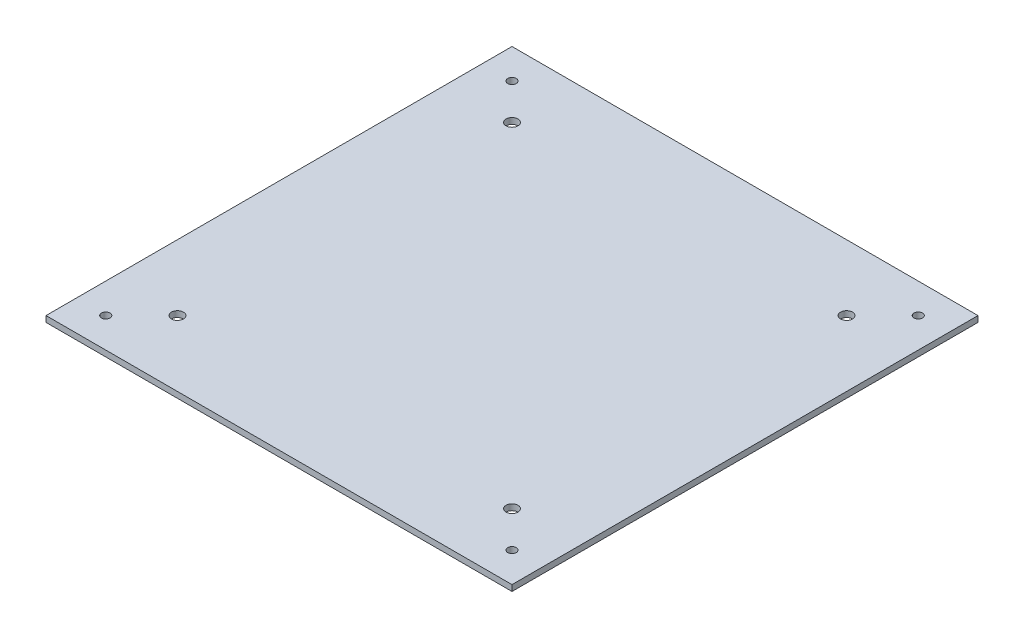
from build123d import *

# Parameters (mm, degrees)
SKETCH1_W           = 241.3
SKETCH1_H           = 241.3
BOSS_EXTRUDE1_DEPTH = 3.175
SKETCH2_R           = 3.175
SKETCH2_R_2         = 2.286
CUT_EXTRUDE1_DEPTH  = 342.264502439
SKETCH3_W           = 247.65
SKETCH3_H           = 247.65
SKETCH3_W_2         = 241.3
SKETCH3_H_2         = 241.3
BOSS_EXTRUDE2_DEPTH = 3.175


with BuildPart() as part:
    # Sketch1 → Boss-Extrude1 (new body)
    with BuildSketch(Plane(origin=(0, 0, 0), x_dir=(1, 0, 0), z_dir=(0, 1, 0))):
        with Locations((120.65, 120.65)):
            Rectangle(SKETCH1_W, SKETCH1_H)
    extrude(amount=BOSS_EXTRUDE1_DEPTH)

    # Sketch2 → Cut-Extrude1 (cut, through all)
    with BuildSketch(Plane(origin=(0, 3.175, 0), x_dir=(1, 0, 0), z_dir=(0, 1, 0))):
        with Locations((209.55, 31.75)):
            Circle(SKETCH2_R)
        with Locations((31.75, 31.75)):
            Circle(SKETCH2_R)
        with Locations((31.75, 209.55)):
            Circle(SKETCH2_R)
        with Locations((209.55, 209.55)):
            Circle(SKETCH2_R)
        with Locations((228.6, 12.7)):
            Circle(SKETCH2_R_2)
        with Locations((12.7, 12.7)):
            Circle(SKETCH2_R_2)
        with Locations((12.7, 228.6)):
            Circle(SKETCH2_R_2)
        with Locations((228.6, 228.6)):
            Circle(SKETCH2_R_2)
    extrude(amount=-CUT_EXTRUDE1_DEPTH, mode=Mode.SUBTRACT)

    # Sketch3 → Boss-Extrude2 (add)
    with BuildSketch(Plane(origin=(0, 3.175, 0), x_dir=(1, 0, 0), z_dir=(0, 1, 0))):
        with Locations((120.65, 120.65)):
            Rectangle(SKETCH3_W, SKETCH3_H)
        with Locations((120.65, 120.65)):
            Rectangle(SKETCH3_W_2, SKETCH3_H_2, mode=Mode.SUBTRACT)
    extrude(amount=-BOSS_EXTRUDE2_DEPTH)


solid = part.part
